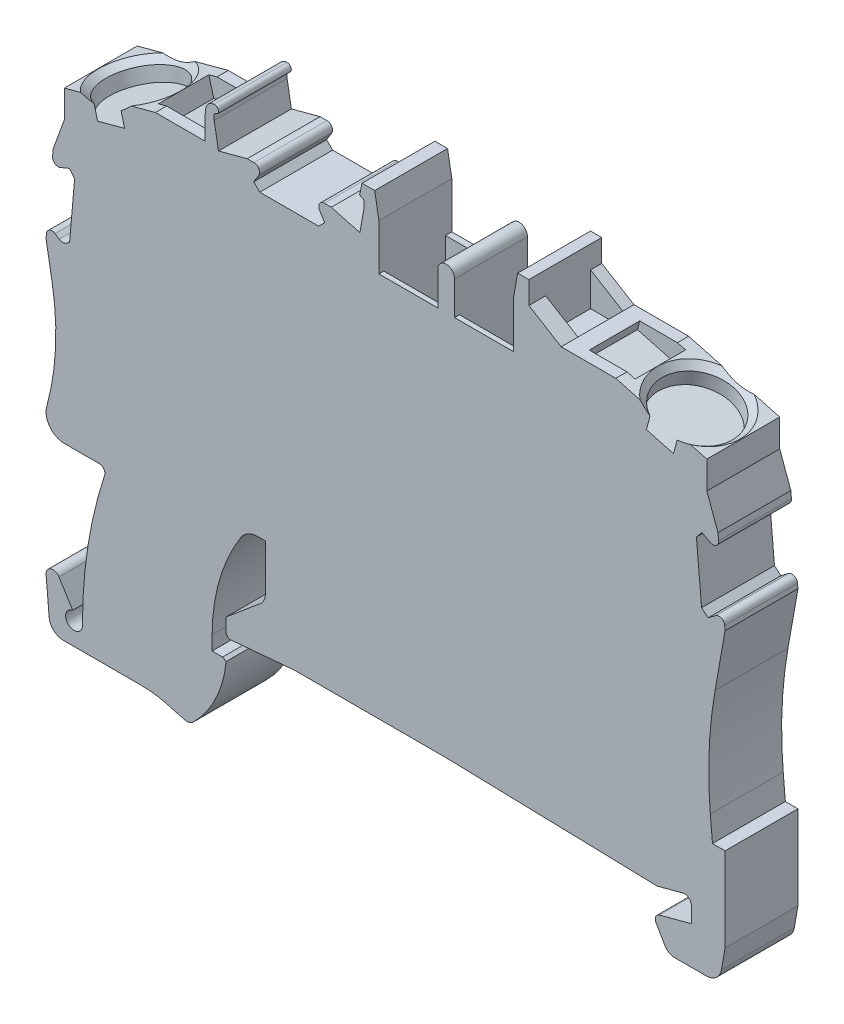
from build123d import *

# Parameters (mm, degrees)
BOSS_EXTRUDE1_START            = -4.4
BOSS_EXTRUDE1_DEPTH            = 4.85
BOSS_EXTRUDE1_2_DEPTH          = 0.45
BOSS_EXTRUDE1_START_2          = -4.429567802
BOSS_EXTRUDE1_3_DEPTH          = 9.229567802
CUT_EXTRUDE1_DEPTH             = 3.2
SKETCH3_W                      = 4.2
SKETCH3_H                      = 0.45
CUT_EXTRUDE2_DEPTH             = 2.4
CUT_EXTRUDE3_START             = -4.85
CUT_EXTRUDE3_DEPTH             = 4.85
SKETCH5_W                      = 4.2
SKETCH5_H                      = 0.45
CUT_EXTRUDE4_DEPTH             = 2.4
SKETCH6_W                      = 1.6
SKETCH6_H                      = 2.8
CUT_EXTRUDE5_DEPTH             = 0.2
SKETCH7_W                      = 1.6
SKETCH7_H                      = 2.8
CUT_EXTRUDE6_DEPTH             = 0.2
BOSS_EXTRUDE2_START            = 0.35
BOSS_EXTRUDE2_DEPTH            = 0.35
SKETCH9_W                      = 2.3
SKETCH9_H                      = 3.2
CUT_EXTRUDE7_DEPTH             = 1
CUT_EXTRUDE8_REACH             = 50.067
SKETCH11_W                     = 3.2
SKETCH11_H                     = 3.6
CUT_EXTRUDE9_REACH             = 53.68
SKETCH13_W                     = 3.2
SKETCH13_H                     = 3.6
F_5_2_5_2_DIAMETER_HOLE1_D     = 5.2
F_5_2_5_2_DIAMETER_HOLE1_DEPTH = 1.43879004
F_5_2_5_2_DIAMETER_HOLE2_D     = 5.2
F_5_2_5_2_DIAMETER_HOLE2_DEPTH = 1.43879004
CHAMFER1_SIZE                  = 0.43879004
CHAMFER2_SIZE                  = 0.264744847
CHAMFER2_SIZE2                 = 0.152106323
FILLET2_R                      = 0.3
FILLET4_R                      = 0.49
FILLET5_START                  = -1
FILLET5_DEPTH                  = 7
FILLET6_R                      = 0.8
FILLET7_R                      = 1
FILLET8_R                      = 1.1
FILLET9_R                      = 1.4
FILLET10_R                     = 7
FILLET11_R                     = 30


with BuildPart() as part:
    # Boss-Extrude1: read off the stored shape, not the designer's step
    # Boss-Extrude1 outline → Boss-Extrude1 (new body)
    with BuildSketch(Plane(origin=(0, 0, 0.45), x_dir=(-1, 0, 0), z_dir=(0, 0, -1)).offset(BOSS_EXTRUDE1_START)):
        with BuildLine():
            Line((-8.2, 29.5), (-12.1, 29.5))
            Line((-12.1, 29.5), (-18.6, 27.758330249))
            Line((-18.6, 27.758330249), (-18.6, 25.786321936))
            Line((-18.6, 25.786321936), (-19.391556209, 23.611539126))
            Line((-19.391556209, 23.611539126), (-19.434262522, 23.123403728))
            ThreePointArc((-19.434262522, 23.123403728), (-19.259691311, 22.757081321), (-18.854682056, 22.731887743))
            Line((-18.854682056, 22.731887743), (-18.245612263, 23.041162873))
            Line((-18.245612263, 23.041162873), (-17.85590258, 22.576724959))
            Line((-17.85590258, 22.576724959), (-18.222473472, 18.386800499))
            Line((-18.222473472, 18.386800499), (-18.686975901, 17.997036682))
            Line((-18.686975901, 17.997036682), (-19.232984571, 18.407402364))
            ThreePointArc((-19.232984571, 18.407402364), (-19.636232113, 18.452959298), (-19.871784351, 18.12250634))
            Line((-19.871784351, 18.12250634), (-19.9, 17.8))
            Line((-19.9, 17.8), (-18.503205639, 9.878385533))
            Line((-18.503205639, 9.878385533), (-19, 4.2))
            Line((-19, 4.2), (-19.9, 4.2))
            Line((-19.9, 4.2), (-19.9, -1.8))
            Line((-19.9, -1.8), (-19.476815246, -4.2))
            Line((-19.476815246, -4.2), (-15.838119785, -4.2))
            Line((-15.838119785, -4.2), (-14.97141459, -2.698822568))
            ThreePointArc((-14.97141459, -2.698822568), (-14.948272939, -2.345749195), (-15.214297133, -2.112452237))
            Line((-15.214297133, -2.112452237), (-17.5, -1.5))
            Line((-17.5, -1.5), (-17.5, -0.4))
            ThreePointArc((-17.5, -0.4), (-17.304380714, -0.00332333), (-16.870590477, 0.082962913))
            Line((-16.870590477, 0.082962913), (-15.067808941, -0.400090944))
            Line((-15.067808941, -0.400090944), (0, 0))
            Line((0, 0), (10.814880796, 0))
            Line((10.814880796, 0), (15.7, -0.42739255))
            Line((15.7, -0.42739255), (15.7, 0.853153829))
            Line((15.7, 0.853153829), (12.9, 3.202632796))
            Line((12.9, 3.202632796), (12.9, 6.95))
            Line((12.9, 6.95), (14.197533314, 6.95))
            ThreePointArc((14.197533314, 6.95), (16.204124528, 2.819362487), (16.661837355, -1.75))
            Line((16.661837355, -1.75), (15.686679324, -1.75))
            ThreePointArc((15.686679324, -1.75), (16.490724125, -4.663948988), (18.318593115, -7.071537346))
            Line((18.318593115, -7.071537346), (20.824804608, -6.4))
            Line((20.824804608, -6.4), (28.245699596, -6.4))
            Line((28.245699596, -6.4), (28.548097349, -2.943577871))
            ThreePointArc((28.548097349, -2.943577871), (28.207640056, -2.425500672), (27.624848914, -2.636852599))
            Line((27.624848914, -2.636852599), (26.651939181, -4.208723074))
            ThreePointArc((26.651939181, -4.208723074), (26.936546563, -5.258891877), (25.95, -4.8))
            Line((25.95, -4.8), (25.95, -4.655844072))
            ThreePointArc((25.95, -4.655844072), (25.552469039, 0.372470816), (24.369753086, 5.275853777))
            ThreePointArc((24.369753086, 5.275853777), (24.426226554, 5.634884558), (24.75, 5.8))
            Line((24.75, 5.8), (27.25, 5.8))
            ThreePointArc((27.25, 5.8), (28.284692771, 6.3129734), (28.502816514, 7.447060201))
            ThreePointArc((28.502816514, 7.447060201), (27.870115389, 11.391412133), (28.122967147, 15.378176342))
            Line((28.122967147, 15.378176342), (28.55, 17.8))
            Line((28.55, 17.8), (28.520912794, 18.132468287))
            ThreePointArc((28.520912794, 18.132468287), (28.299580434, 18.45624155), (27.907947968, 18.435237963))
            Line((27.907947968, 18.435237963), (27.310928713, 18.055970455))
            Line((27.310928713, 18.055970455), (26.868972598, 18.426815668))
            Line((26.868972598, 18.426815668), (26.509403454, 22.536709789))
            Line((26.509403454, 22.536709789), (26.880248667, 22.978665904))
            Line((26.880248667, 22.978665904), (27.53405697, 22.708831627))
            ThreePointArc((27.53405697, 22.708831627), (27.923386893, 22.756153397), (28.08513408, 23.113441777))
            Line((28.08513408, 23.113441777), (28.041556209, 23.611539126))
            Line((28.041556209, 23.611539126), (27.25, 25.786321936))
            Line((27.25, 25.786321936), (27.25, 27.758330249))
            Line((27.25, 27.758330249), (20.75, 29.5))
            Line((20.75, 29.5), (17.2, 29.5))
            Line((17.2, 29.5), (17.2, 31.1))
            Line((17.2, 31.1), (17.112511336, 32.1))
            Line((17.112511336, 32.1), (16.55, 32.1))
            ThreePointArc((16.55, 32.1), (16.293706985, 31.955929119), (16.283576372, 31.662092601))
            Line((16.283576372, 31.662092601), (16.55, 31.52))
            Line((16.55, 31.52), (16.55, 31.1))
            Line((16.55, 31.1), (16.24530052, 29.371963377))
            Line((16.24530052, 29.371963377), (14.2, 29.92))
            Line((14.2, 29.92), (13.71, 29.92))
            ThreePointArc((13.71, 29.92), (13.360274785, 29.714144982), (13.370513022, 29.308461371))
            Line((13.370513022, 29.308461371), (13.731729347, 28.728764702))
            Line((13.731729347, 28.728764702), (13.302964646, 28.3))
            Line((13.302964646, 28.3), (9.097035354, 28.3))
            Line((9.097035354, 28.3), (8.668270653, 28.728764702))
            Line((8.668270653, 28.728764702), (9.029486978, 29.308461371))
            ThreePointArc((9.029486978, 29.308461371), (9.039725215, 29.714144982), (8.69, 29.92))
            Line((8.69, 29.92), (8.2, 29.92))
            Line((8.2, 29.92), (6.15469948, 29.371963377))
            Line((6.15469948, 29.371963377), (5.85, 31.1))
            Line((5.85, 31.1), (5.85, 31.52))
            Line((5.85, 31.52), (6.176922839, 31.694358848))
            Line((6.176922839, 31.694358848), (6.005678526, 32.5))
            Line((6.005678526, 32.5), (5.1, 32.5))
            Line((5.1, 32.5), (4.8, 30.798615454))
            Line((4.8, 30.798615454), (4.8, 20.5))
            Line((4.8, 20.5), (3.5, 19))
            Line((3.5, 19), (1.9, 19))
            Line((1.9, 19), (0.6, 20.7))
            Line((0.6, 20.7), (0.6, 29.9))
            ThreePointArc((0.6, 29.9), (0, 30.5), (-0.6, 29.9))
            Line((-0.6, 29.9), (-0.6, 20.7))
            Line((-0.6, 20.7), (-1.9, 19))
            Line((-1.9, 19), (-3.5, 19))
            Line((-3.5, 19), (-4.8, 20.5))
            Line((-4.8, 20.5), (-4.8, 30.798615454))
            Line((-4.8, 30.798615454), (-5.1, 32.5))
            Line((-5.1, 32.5), (-5.9, 32.5))
            Line((-5.9, 32.5), (-5.9, 30.9))
            Line((-5.9, 30.9), (-8.2, 29.5))
        make_face()
    extrude(amount=BOSS_EXTRUDE1_DEPTH)

    # Boss-Extrude1 2 outline → Boss-Extrude1 2 (add)
    with BuildSketch(Plane(origin=(0, 0, 0.45), x_dir=(-1, 0, 0), z_dir=(0, 0, -1))):
        Polygon((-0.6, 29.9), (-4.8, 29.9), (-4.8, 20.5), (-3.5, 19), (-1.9, 19), (-0.6, 20.7), align=None)
        Polygon((4.8, 29.9), (0.6, 29.9), (0.6, 20.7), (1.9, 19), (3.5, 19), (4.8, 20.5), align=None)
    extrude(amount=BOSS_EXTRUDE1_2_DEPTH)

    # Boss-Extrude1 3 outline → Boss-Extrude1 3 (add)
    with BuildSketch(Plane.YZ.offset(BOSS_EXTRUDE1_START_2)):
        Polygon((20.072578233, 0.45), (19, 1.35), (19, 0.45), align=None)
        Polygon((19, 4.15), (19.1, 4.15), (19.934227515, 4.85), (19, 4.85), align=None)
    extrude(amount=BOSS_EXTRUDE1_3_DEPTH)

    # Sketch2 → Cut-Extrude1 (cut)
    with BuildSketch(Plane(origin=(0, 0, 0.8), x_dir=(-1, 0, 0), z_dir=(0, 0, -1))):
        Polygon((-8.2, 29.5), (-5.9, 29.5), (-5.9, 30.9), align=None)
    extrude(amount=-CUT_EXTRUDE1_DEPTH, mode=Mode.SUBTRACT)

    # Sketch3 → Cut-Extrude2 (cut)
    with BuildSketch(Plane(origin=(0, 29.9, 0), x_dir=(-1, 0, 0), z_dir=(0, 1, 0))):
        with Locations((2.7, 0.225)):
            Rectangle(SKETCH3_W, SKETCH3_H)
    extrude(amount=-CUT_EXTRUDE2_DEPTH, mode=Mode.SUBTRACT)

    # Sketch4 → Cut-Extrude3 (cut)
    with BuildSketch(Plane(origin=(0, 0, 0), x_dir=(-1, 0, 0), z_dir=(0, 0, -1)).offset(CUT_EXTRUDE3_START)):
        with BuildLine():
            Line((16.7, -1.75), (16.7, -0.750797858))
            ThreePointArc((16.7, -0.750797858), (16.690455862, -1.250763184), (16.661837355, -1.75))
            Line((16.661837355, -1.75), (16.7, -1.75))
        make_face()
    extrude(amount=CUT_EXTRUDE3_DEPTH, mode=Mode.SUBTRACT)

    # Sketch5 → Cut-Extrude4 (cut)
    with BuildSketch(Plane(origin=(0, 29.9, 0), x_dir=(-1, 0, 0), z_dir=(0, 1, 0))):
        with Locations((-2.7, 0.225)):
            Rectangle(SKETCH5_W, SKETCH5_H)
    extrude(amount=-CUT_EXTRUDE4_DEPTH, mode=Mode.SUBTRACT)

    # Sketch6 → Cut-Extrude5 (cut)
    with BuildSketch(Plane(origin=(0, 19, 0), x_dir=(-1, 0, 0), z_dir=(0, 1, 0))):
        with Locations((2.7, 2.75)):
            Rectangle(SKETCH6_W, SKETCH6_H)
    extrude(amount=-CUT_EXTRUDE5_DEPTH, mode=Mode.SUBTRACT)

    # Sketch7 → Cut-Extrude6 (cut)
    with BuildSketch(Plane(origin=(0, 19, 0), x_dir=(-1, 0, 0), z_dir=(0, 1, 0))):
        with Locations((-2.7, 2.75)):
            Rectangle(SKETCH7_W, SKETCH7_H)
    extrude(amount=-CUT_EXTRUDE6_DEPTH, mode=Mode.SUBTRACT)

    # Sketch8 → Boss-Extrude2 (add)
    with BuildSketch(Plane.XY.offset(4.85).offset(BOSS_EXTRUDE2_START)):
        with BuildLine():
            Line((8.2, 29.5), (12.1, 29.5))
            Line((12.1, 29.5), (18.6, 27.758330249))
            Line((18.6, 27.758330249), (18.6, 25.786321936))
            Line((18.6, 25.786321936), (19.391556209, 23.611539126))
            Line((19.391556209, 23.611539126), (19.434262522, 23.123403728))
            ThreePointArc((19.434262522, 23.123403728), (19.259691311, 22.757081321), (18.854682056, 22.731887743))
            Line((18.854682056, 22.731887743), (18.245612263, 23.041162873))
            Line((18.245612263, 23.041162873), (17.85590258, 22.576724959))
            Line((17.85590258, 22.576724959), (18.222473472, 18.386800499))
            Line((18.222473472, 18.386800499), (18.686975901, 17.997036682))
            Line((18.686975901, 17.997036682), (19.232984571, 18.407402364))
            ThreePointArc((19.232984571, 18.407402364), (19.636232113, 18.452959298), (19.871784351, 18.12250634))
            Line((19.871784351, 18.12250634), (19.9, 17.8))
            Line((19.9, 17.8), (18.503205639, 9.878385533))
            Line((18.503205639, 9.878385533), (19, 4.2))
            Line((19, 4.2), (19.9, 4.2))
            Line((19.9, 4.2), (19.9, -1.8))
            Line((19.9, -1.8), (19.476815246, -4.2))
            Line((19.476815246, -4.2), (15.838119785, -4.2))
            Line((15.838119785, -4.2), (14.97141459, -2.698822568))
            ThreePointArc((14.97141459, -2.698822568), (14.948272939, -2.345749195), (15.214297134, -2.112452237))
            Line((15.214297134, -2.112452237), (17.5, -1.5))
            Line((17.5, -1.5), (17.5, -0.4))
            ThreePointArc((17.5, -0.4), (17.304380715, -0.00332333), (16.870590477, 0.082962913))
            Line((16.870590477, 0.082962913), (15.067808941, -0.400090944))
            Line((15.067808941, -0.400090944), (0, 0))
            Line((0, 0), (-10.814880796, 0))
            Line((-10.814880796, 0), (-15.7, -0.42739255))
            Line((-15.7, -0.42739255), (-15.7, 0.853153829))
            Line((-15.7, 0.853153829), (-12.9, 3.202632796))
            Line((-12.9, 3.202632796), (-12.9, 6.95))
            Line((-12.9, 6.95), (-14.197533314, 6.95))
            ThreePointArc((-14.197533314, 6.95), (-16.058685453, 3.297801503), (-16.7, -0.750797858))
            Line((-16.7, -0.750797858), (-16.7, -1.75))
            Line((-16.7, -1.75), (-15.686679324, -1.75))
            ThreePointArc((-15.686679324, -1.75), (-16.490724125, -4.663948988), (-18.318593115, -7.071537346))
            Line((-18.318593115, -7.071537346), (-20.824804608, -6.4))
            Line((-20.824804608, -6.4), (-28.245699596, -6.4))
            Line((-28.245699596, -6.4), (-28.548097349, -2.943577871))
            ThreePointArc((-28.548097349, -2.943577871), (-28.207640057, -2.425500672), (-27.624848914, -2.636852599))
            Line((-27.624848914, -2.636852599), (-26.651939181, -4.208723074))
            ThreePointArc((-26.651939181, -4.208723074), (-26.936546564, -5.258891876), (-25.95, -4.8))
            Line((-25.95, -4.8), (-25.95, -4.655844072))
            ThreePointArc((-25.95, -4.655844072), (-25.552469039, 0.372470816), (-24.369753086, 5.275853777))
            ThreePointArc((-24.369753086, 5.275853777), (-24.426226554, 5.634884558), (-24.75, 5.8))
            Line((-24.75, 5.8), (-27.25, 5.8))
            ThreePointArc((-27.25, 5.8), (-28.284692771, 6.3129734), (-28.502816514, 7.447060201))
            ThreePointArc((-28.502816514, 7.447060201), (-27.870115389, 11.391412133), (-28.122967147, 15.378176342))
            Line((-28.122967147, 15.378176342), (-28.55, 17.8))
            Line((-28.55, 17.8), (-28.520912794, 18.132468287))
            ThreePointArc((-28.520912794, 18.132468287), (-28.299580434, 18.45624155), (-27.907947968, 18.435237963))
            Line((-27.907947968, 18.435237963), (-27.310928713, 18.055970455))
            Line((-27.310928713, 18.055970455), (-26.868972598, 18.426815668))
            Line((-26.868972598, 18.426815668), (-26.509403454, 22.536709789))
            Line((-26.509403454, 22.536709789), (-26.880248667, 22.978665904))
            Line((-26.880248667, 22.978665904), (-27.53405697, 22.708831627))
            ThreePointArc((-27.53405697, 22.708831627), (-27.923386893, 22.756153397), (-28.08513408, 23.113441777))
            Line((-28.08513408, 23.113441777), (-28.041556209, 23.611539126))
            Line((-28.041556209, 23.611539126), (-27.25, 25.786321936))
            Line((-27.25, 25.786321936), (-27.25, 27.758330249))
            Line((-27.25, 27.758330249), (-20.75, 29.5))
            Line((-20.75, 29.5), (-17.2, 29.5))
            Line((-17.2, 29.5), (-17.2, 31.1))
            Line((-17.2, 31.1), (-17.112511336, 32.1))
            Line((-17.112511336, 32.1), (-16.55, 32.1))
            ThreePointArc((-16.55, 32.1), (-16.293706985, 31.955929119), (-16.283576372, 31.662092601))
            Line((-16.283576372, 31.662092601), (-16.55, 31.52))
            Line((-16.55, 31.52), (-16.55, 31.1))
            Line((-16.55, 31.1), (-16.24530052, 29.371963377))
            Line((-16.24530052, 29.371963377), (-14.2, 29.92))
            Line((-14.2, 29.92), (-13.71, 29.92))
            ThreePointArc((-13.71, 29.92), (-13.360274785, 29.714144982), (-13.370513022, 29.308461371))
            Line((-13.370513022, 29.308461371), (-13.731729347, 28.728764702))
            Line((-13.731729347, 28.728764702), (-13.302964646, 28.3))
            Line((-13.302964646, 28.3), (-9.097035354, 28.3))
            Line((-9.097035354, 28.3), (-8.668270653, 28.728764702))
            Line((-8.668270653, 28.728764702), (-9.029486978, 29.308461371))
            ThreePointArc((-9.029486978, 29.308461371), (-9.039725215, 29.714144982), (-8.69, 29.92))
            Line((-8.69, 29.92), (-8.2, 29.92))
            Line((-8.2, 29.92), (-6.15469948, 29.371963377))
            Line((-6.15469948, 29.371963377), (-5.85, 31.1))
            Line((-5.85, 31.1), (-5.85, 31.52))
            Line((-5.85, 31.52), (-6.176922839, 31.694358848))
            Line((-6.176922839, 31.694358848), (-6.005678526, 32.5))
            Line((-6.005678526, 32.5), (-5.1, 32.5))
            Line((-5.1, 32.5), (-4.8, 30.798615454))
            Line((-4.8, 30.798615454), (-4.8, 27.5))
            Line((-4.8, 27.5), (-0.6, 27.5))
            Line((-0.6, 27.5), (-0.6, 29.9))
            ThreePointArc((-0.6, 29.9), (0, 30.5), (0.6, 29.9))
            Line((0.6, 29.9), (0.6, 27.5))
            Line((0.6, 27.5), (4.8, 27.5))
            Line((4.8, 27.5), (4.8, 30.798615454))
            Line((4.8, 30.798615454), (5.1, 32.5))
            Line((5.1, 32.5), (5.9, 32.5))
            Line((5.9, 32.5), (5.9, 30.9))
            Line((5.9, 30.9), (8.2, 29.5))
        make_face()
    extrude(amount=-BOSS_EXTRUDE2_DEPTH)

    # Sketch9 → Cut-Extrude7 (cut)
    with BuildSketch(Plane(origin=(0, 29.5, 0), x_dir=(-1, 0, 0), z_dir=(0, 1, 0))):
        with Locations((-7.05, 2.4)):
            Rectangle(SKETCH9_W, SKETCH9_H)
    extrude(amount=-CUT_EXTRUDE7_DEPTH, mode=Mode.SUBTRACT)

    # Sketch11 → Cut-Extrude8 (cut, up to next)
    with BuildSketch(Plane(origin=(-8.418482076, 31.41820283, 0), x_dir=(0.9659258262890731, 0.25881904510250303, 0), z_dir=(0.25881904510250303, -0.9659258262890731, 0)), mode=Mode.PRIVATE) as cut_extrude8_sk1:
        with Locations((-11.409442825, 2.6)):
            Rectangle(SKETCH11_W, SKETCH11_H)
    cut_extrude8_tool1 = extrude(cut_extrude8_sk1.sketch, amount=-CUT_EXTRUDE8_REACH, mode=Mode.PRIVATE) & part.part
    add(cut_extrude8_tool1.solids().sort_by_distance((-19.439158, 28.465222, 2.6))[0], mode=Mode.SUBTRACT)

    # Sketch13 → Cut-Extrude9 (cut, up to next)
    with BuildSketch(Plane(origin=(7.839041947, 29.25570283, 0), x_dir=(0.965925826289067, -0.258819045102526, 0), z_dir=(-0.258819045102526, -0.965925826289067, 0)), mode=Mode.PRIVATE) as cut_extrude9_sk1:
        with Locations((3.054184427, 2.6)):
            Rectangle(SKETCH13_W, SKETCH13_H)
    cut_extrude9_tool1 = extrude(cut_extrude9_sk1.sketch, amount=-CUT_EXTRUDE9_REACH, mode=Mode.PRIVATE) & part.part
    add(cut_extrude9_tool1.solids().sort_by_distance((10.789158, 28.465222, 2.6))[0], mode=Mode.SUBTRACT)

    # Ø5.2 (5.2) Diameter Hole1
    with Locations(Plane(origin=(8.185546307, 30.548874706, 0), x_dir=(0.965925826289075, -0.25881904510249604, 0), z_dir=(0.258819045102496, 0.9659258262890749, 0))):
        with Locations((7.704184427, -2.8)):
            Hole(F_5_2_5_2_DIAMETER_HOLE1_D / 2, depth=F_5_2_5_2_DIAMETER_HOLE1_DEPTH)

    # Ø5.2 (5.2) Diameter Hole2
    with Locations(Plane(origin=(-8.764986436, 32.711374706, 0), x_dir=(0.9659258262890752, 0.2588190451024951, 0), z_dir=(-0.2588190451024951, 0.9659258262890753, 0))):
        with Locations((-16.059442825, -2.8)):
            Hole(F_5_2_5_2_DIAMETER_HOLE2_D / 2, depth=F_5_2_5_2_DIAMETER_HOLE2_DEPTH)

    # Chamfer1
    # the kernel refuses this chamfer: 0.43879004 mm, written as the material it takes off along each edge
    with BuildSketch(Plane(origin=(15.627217016, 28.554885049, 2.8), x_dir=(-0.5941255800666257, 0.15919546939959545, 0.7884615384615398), z_dir=(0.7615953630391457, -0.20406886247149558, 0.6150840612199784))) as chamfer1_piece_1:
        Polygon((2.6, CHAMFER1_SIZE * 1.0000000011), (2.6 + CHAMFER1_SIZE * 1.0000000011, 0), (2.6, 0), align=None)
    revolve(axis=Axis((15.627217016, 28.554885049, 2.8), (-0.25881904510249587, -0.9659258262890751, 2.215855277043488e-11)), revolution_arc=284.083942839, mode=Mode.SUBTRACT)
    with BuildSketch(Plane(origin=(-24.277217016, 28.554885049, 2.8), x_dir=(-0.5941255800666476, -0.15919546939960366, 0.7884615384615214), z_dir=(0.7615953630391284, 0.20406886247148906, 0.6150840612200016))) as chamfer1_piece_2:
        Polygon((2.6, CHAMFER1_SIZE * 1.0000000011), (2.6 + CHAMFER1_SIZE * 1.0000000011, 0), (2.6, 0), align=None)
    revolve(axis=Axis((-24.277217016, 28.554885049, 2.8), (0.2588190451024959, -0.965925826289075, -2.2161592005964795e-11)), revolution_arc=284.083942839, mode=Mode.SUBTRACT)
    with BuildSketch(Plane(origin=(-24.277217016, 28.554885049, 2.8), x_dir=(0.760973278642287, 0.2039021754738426, 0.615908736769858), z_dir=(0.5949221554830857, 0.15940891112105865, -0.7878175093069192))) as chamfer1_piece_3:
        Polygon((2.6 + CHAMFER1_SIZE * 1.0000000011, 0), (2.6, CHAMFER1_SIZE * 1.0000000011), (2.6, 0), align=None)
    revolve(axis=Axis((-24.277217016, 28.554885049, 2.8), (0.2588190451024951, -0.9659258262890753, 0)), revolution_arc=89.940048148, mode=Mode.SUBTRACT)
    with BuildSketch(Plane(origin=(-24.277217016, 28.554885049, 2.8), x_dir=(0.5941255800711691, 0.15919546938272552, 0.7884615384615223), z_dir=(0.7615953630356015, 0.20406886248465542, -0.6150840612200007))) as chamfer1_piece_4:
        Polygon((2.6, CHAMFER1_SIZE * 1.0000000011), (2.6 + CHAMFER1_SIZE * 1.0000000011, 0), (2.6, 0), align=None)
    revolve(axis=Axis((-24.277217016, 28.554885049, 2.8), (0.2588190451024951, -0.9659258262890753, 0)), revolution_arc=89.940048148, mode=Mode.SUBTRACT)
    with BuildSketch(Plane(origin=(15.627217016, 28.554885049, 2.8), x_dir=(0.7609732786422952, -0.20390217547384534, 0.615908736769847), z_dir=(0.5949221554830749, -0.1594089111210564, -0.7878175093069278))) as chamfer1_piece_5:
        Polygon((2.6 + CHAMFER1_SIZE * 1.0000000011, 0), (2.6, CHAMFER1_SIZE * 1.0000000011), (2.6, 0), align=None)
    revolve(axis=Axis((15.627217016, 28.554885049, 2.8), (-0.25881904510249604, -0.965925826289075, 0)), revolution_arc=89.940048148, mode=Mode.SUBTRACT)
    with BuildSketch(Plane(origin=(15.627217016, 28.554885049, 2.8), x_dir=(0.5941255800711474, -0.15919546938272008, 0.7884615384615399), z_dir=(0.7615953630356181, -0.2040688624846607, -0.6150840612199783))) as chamfer1_piece_6:
        Polygon((2.6, CHAMFER1_SIZE * 1.0000000011), (2.6 + CHAMFER1_SIZE * 1.0000000011, 0), (2.6, 0), align=None)
    revolve(axis=Axis((15.627217016, 28.554885049, 2.8), (-0.25881904510249604, -0.965925826289075, 0)), revolution_arc=89.940048148, mode=Mode.SUBTRACT)

    # Chamfer2
    chamfer2_edges = [part.edges().sort_by_distance(p)[0] for p in [
        (-15.686679324, -1.75, 2.425),
    ]]
    chamfer2_side = [part.faces().sort_by_distance(p)[0] for p in [
        (-16.193339662, -1.75, 2.6),
    ]]
    chamfer(chamfer2_edges, length=CHAMFER2_SIZE, length2=CHAMFER2_SIZE2, reference=chamfer2_side[0])

    # Fillet2
    fillet2_edges = [part.edges().sort_by_distance(p)[0] for p in [
        (-15.7, -0.42739255, 2.425),
    ]]
    fillet(fillet2_edges, radius=FILLET2_R)

    # Fillet4
    fillet4_edges = [part.edges().sort_by_distance(p)[0] for p in [
        (-27.310928713, 18.055970455, 2.425),
    ]]
    fillet(fillet4_edges, radius=FILLET4_R)

    # Fillet5: read off the stored shape, not the designer's step
    # Fillet5 outline → Fillet5 (cut)
    with BuildSketch(Plane.XY.offset(FILLET5_START)):
        with BuildLine():
            Line((-17.112511336, 32.1), (-17.164348497, 31.507498542))
            ThreePointArc((-17.164348497, 31.507498542), (-16.968047149, 31.918710338), (-16.55, 32.1))
            Line((-16.55, 32.1), (-17.112511336, 32.1))
        make_face()
        with BuildLine():
            ThreePointArc((-18.043546552, -6.812744144), (-18.333928625, -6.978418543), (-18.668247977, -6.977847608))
            Line((-18.668247977, -6.977847608), (-18.318593115, -7.071537346))
            ThreePointArc((-18.318593115, -7.071537346), (-18.179542512, -6.943763989), (-18.043546552, -6.812744144))
        make_face()
    extrude(amount=FILLET5_DEPTH, mode=Mode.SUBTRACT)

    # Fillet6
    fillet6_edges = [part.edges().sort_by_distance(p)[0] for p in [
        (15.838119785, -4.2, 2.425),
    ]]
    fillet(fillet6_edges, radius=FILLET6_R)

    # Fillet7
    fillet7_edges = [part.edges().sort_by_distance(p)[0] for p in [
        (-28.245699596, -6.4, 2.425),
        (-12.9, 3.202632796, 2.425),
    ]]
    fillet(fillet7_edges, radius=FILLET7_R)

    # Fillet8
    fillet8_edges = [part.edges().sort_by_distance(p)[0] for p in [
        (19.476815246, -4.2, 2.425),
    ]]
    fillet(fillet8_edges, radius=FILLET8_R)

    # Fillet9
    fillet9_edges = [part.edges().sort_by_distance(p)[0] for p in [
        (-14.197533314, 6.95, 2.425),
    ]]
    fillet(fillet9_edges, radius=FILLET9_R)

    # Fillet10
    fillet10_edges = [part.edges().sort_by_distance(p)[0] for p in [
        (-20.824804608, -6.4, 2.425),
    ]]
    fillet(fillet10_edges, radius=FILLET10_R)

    # Fillet11
    fillet11_edges = [part.edges().sort_by_distance(p)[0] for p in [
        (18.503205639, 9.878385533, 2.425),
    ]]
    fillet(fillet11_edges, radius=FILLET11_R)


solid = part.part
